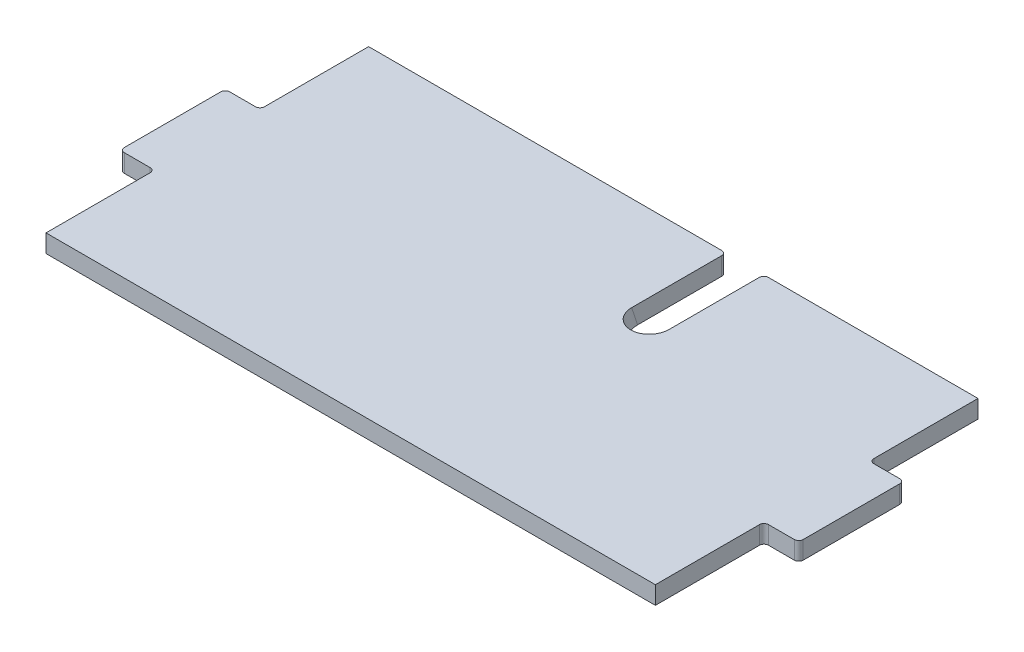
from build123d import *

# Parameters (mm, degrees)
BOSS_EXTRUDE1_DEPTH     = 6.35
CAVITY1_START           = -18.343561252
CAVITY1_OUTLINE_R       = 12.7
CAVITY1_DEPTH           = 21.704189785
CUT_EXTRUDE1_REACH      = 334.451
CUT_EXTRUDE1_END_RADIUS = 12.7
SKETCH4_W               = 25.4
SKETCH4_H               = 12.7
MOVE_FACE_SLOT_BY       = 0.762
MOVE_FACE_SLOT_2_BY     = 0.762
MOVE_FACE_SLOT_3_BY     = 0.762
MOVE_FACE_SLOT_4_BY     = 0.762
MOVE_FACE_SLOT_5_BY     = 0.762
MOVE_FACE_SLOT_6_BY     = 0.762
MOVE_START              = -33.759043645
MOVE_FACE_HOLE_DEPTH    = 37.328109508
FILLET1_R               = 3.175


# Read off the part's stored shape, not the designer's step: Cavity1, Move Face hole
with BuildPart() as part:
    # Sketch1 → Boss-Extrude1 (new, symmetric)
    with BuildSketch(Plane(origin=(0, 0, 0), x_dir=(1, 0, 0), z_dir=(0, 1, 0))):
        Polygon((-215.9, -139.7), (215.9, -139.7), (215.9, -63.5), (241.3, -63.5), (241.3, 12.7), (215.9, 12.7), (215.9, 88.9), (-215.9, 88.9), (-215.9, 12.7), (-241.3, 12.7), (-241.3, -63.5), (-215.9, -63.5), align=None)
    extrude(amount=BOSS_EXTRUDE1_DEPTH, both=True)

    # Cavity1 outline → Cavity1 (cut)
    with BuildSketch(Plane(origin=(0, 0, 0), x_dir=(1, 0, 0), z_dir=(0, 0.9501228611580828, 0.31187585463574896)).offset(CAVITY1_START)):
        with Locations((50.8, 22.822585801)):
            Circle(CAVITY1_OUTLINE_R)
    extrude(amount=CAVITY1_DEPTH, mode=Mode.SUBTRACT)

    # Cut-Extrude1: up to this cylinder (the profile starts outside it)
    cut_extrude1_end = Plane(origin=(50.8, -19.225068271, -30.3312567), z_dir=(0, -0.9501228611580824, -0.3118758546357494)) * Cylinder(CUT_EXTRUDE1_END_RADIUS, 695.302, mode=Mode.PRIVATE)
    # Sketch4 → Cut-Extrude1 (cut, up to the surface)
    with BuildSketch(Plane(origin=(0, 0, -88.9), x_dir=(-1, 0, 0), z_dir=(0, 0, -1)), mode=Mode.PRIVATE) as cut_extrude1_sk1:
        with Locations((-50.8, 0)):
            Rectangle(SKETCH4_W, SKETCH4_H)
    cut_extrude1_tool1 = extrude(cut_extrude1_sk1.sketch, amount=-CUT_EXTRUDE1_REACH, mode=Mode.PRIVATE) - cut_extrude1_end
    add(cut_extrude1_tool1.solids().sort_by_distance((50.8, 0, -88.9))[0], mode=Mode.SUBTRACT)

    # Move Face slot: a face moved inward by 0.762
    extrude(part.faces().sort_by_distance((228.6, 0, 63.5))[0], amount=MOVE_FACE_SLOT_BY, dir=(0, 0, -1), mode=Mode.SUBTRACT)

    # Move Face slot 2: a face moved inward by 0.762
    extrude(part.faces().sort_by_distance((228.6, 0, -12.7))[0], amount=MOVE_FACE_SLOT_2_BY, dir=(0, 0, 1), mode=Mode.SUBTRACT)

    # Move Face slot 3: a face moved inward by 0.762
    extrude(part.faces().sort_by_distance((241.3, 0, 25.4))[0], amount=MOVE_FACE_SLOT_3_BY, dir=(-1, 0, 0), mode=Mode.SUBTRACT)

    # Move Face slot 4: a face moved inward by 0.762
    extrude(part.faces().sort_by_distance((-228.6, 0, 63.5))[0], amount=MOVE_FACE_SLOT_4_BY, dir=(0, 0, -1), mode=Mode.SUBTRACT)

    # Move Face slot 5: a face moved inward by 0.762
    extrude(part.faces().sort_by_distance((-241.3, 0, 25.4))[0], amount=MOVE_FACE_SLOT_5_BY, dir=(1, 0, 0), mode=Mode.SUBTRACT)

    # Move Face slot 6: a face moved inward by 0.762
    extrude(part.faces().sort_by_distance((-228.6, 0, -12.7))[0], amount=MOVE_FACE_SLOT_6_BY, dir=(0, 0, 1), mode=Mode.SUBTRACT)

    # Move Face hole outline → Move Face hole (cut)
    with BuildSketch(Plane(origin=(0, 0, 0), x_dir=(1, 0, 0), z_dir=(0, 0.9501228611580828, 0.31187585463574896)).offset(MOVE_START)):
        with BuildLine():
            ThreePointArc((37.465, 22.822585801), (50.8, 9.487585801), (64.135, 22.822585801))
            Line((64.135, 22.822585801), (64.135, 88))
            Line((64.135, 88), (63.5, 88))
            Line((63.5, 88), (63.5, 22.822585801))
            ThreePointArc((63.5, 22.822585801), (50.8, 10.122585801), (38.1, 22.822585801))
            Line((38.1, 22.822585801), (38.1, 88))
            Line((38.1, 88), (37.465, 88))
            Line((37.465, 88), (37.465, 22.822585801))
        make_face()
    extrude(amount=MOVE_FACE_HOLE_DEPTH, mode=Mode.SUBTRACT)

    # Fillet1
    fillet1_edges = [part.edges().sort_by_distance(p)[0] for p in [
        (-215.9, 0, -11.938),
        (-240.538, 0, -11.938),
        (-240.538, 0, 62.738),
        (-215.9, 0, 62.738),
        (64.135, 0, -88.9),
        (37.465, 0, -88.9),
        (215.9, 0, 62.738),
        (240.538, 0, 62.738),
        (240.538, 0, -11.938),
        (215.9, 0, -11.938),
    ]]
    fillet(fillet1_edges, radius=FILLET1_R)


solid = part.part
